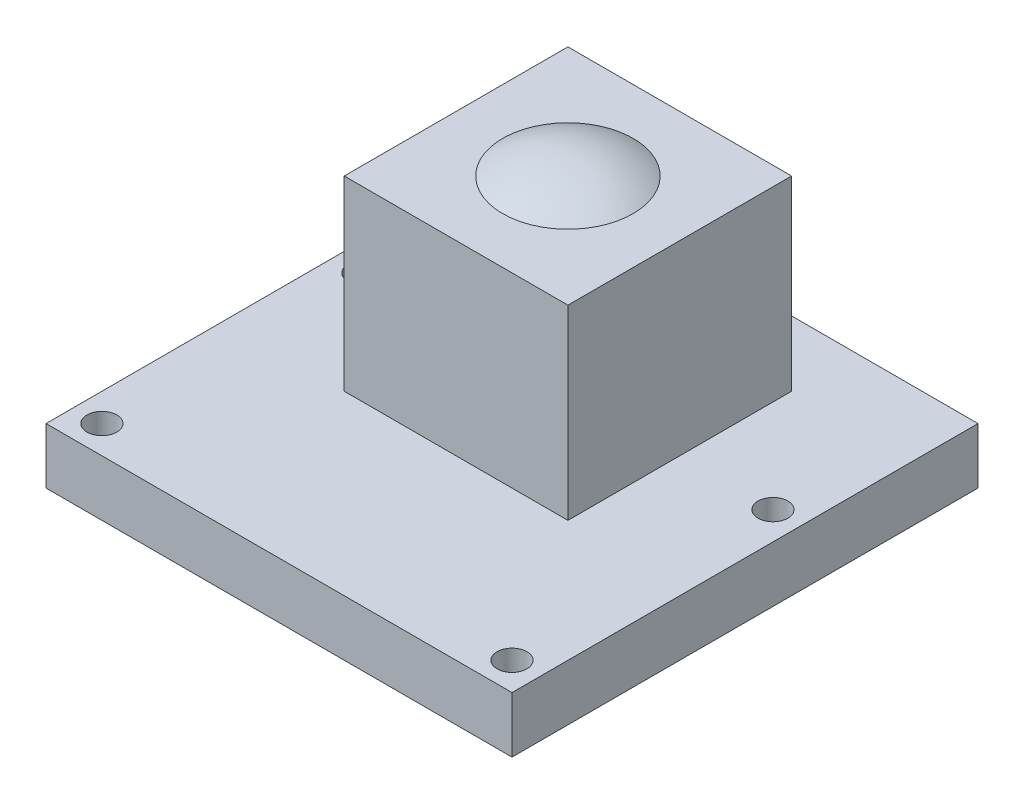
from build123d import *

# Parameters (mm, degrees)
SKETCH1_W             = 25
SKETCH1_H             = 25
BASE_PLATE_DEPTH      = 3
M2X0_4_TAPPED_HOLE1_D = 1.6
SKETCH6_W             = 12
SKETCH6_H             = 12
LENSE_BASE_DEPTH      = 10


# Read off the part's stored shape, not the designer's step: lense
with BuildPart() as part:
    # Sketch1 → base_plate (new body)
    with BuildSketch(Plane(origin=(0, 0, 0), x_dir=(1, 0, 0), z_dir=(0, 1, 0))):
        Rectangle(SKETCH1_W, SKETCH1_H)
    extrude(amount=BASE_PLATE_DEPTH)

    # M2x0.4 Tapped Hole1 (through all)
    with Locations(Plane(origin=(-11, 3, -3), x_dir=(0, 0, 1), z_dir=(0, 1, 0))):
        with Locations((0, 0), (14, 0), (14, 22), (0, 22)):
            Hole(M2X0_4_TAPPED_HOLE1_D / 2)

    # Sketch6 → lense_base (add)
    with BuildSketch(Plane(origin=(0, 3, 0), x_dir=(1, 0, 0), z_dir=(0, 1, 0))):
        with Locations((0, 3)):
            Rectangle(SKETCH6_W, SKETCH6_H)
    extrude(amount=LENSE_BASE_DEPTH)

    # lense outline → lense (revolve)
    with BuildSketch(Plane.XY.offset(-3)):
        with BuildLine():
            Line((0, 12.999999997), (3.500000006, 12.999999997))
            ThreePointArc((3.500000006, 12.999999997), (1.820027476, 13.745096152), (0, 14))
            Line((0, 14), (0, 12.999999997))
        make_face()
    revolve(axis=Axis((0, 0, -3), (0, 1, 0)))


solid = part.part
